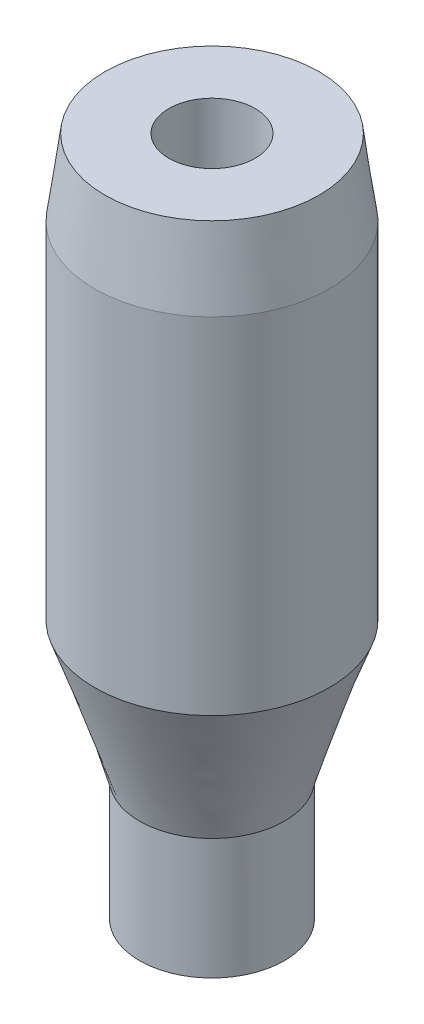
from build123d import *

# Parameters (mm, degrees)
SKETCH_1_R          = 2.1
EXTRUDE_1_DEPTH     = 7.5
SKETCH_5_R          = 3.4
EXTRUDE_2_DEPTH     = 10
SKETCH_7_R          = 3.1
SKETCH_6_R          = 3.4
SKETCH_8_R          = 1.25
CUT_EXTRUDE_1_DEPTH = 21.27831367


with BuildPart() as part:
    # 草图1 → 凸台-拉伸1 (new body)
    with BuildSketch(Plane(origin=(0, 0, 0), x_dir=(1, 0, 0), z_dir=(0, 1, 0))):
        with Locations(Location((0, 0, 0), (0, 0, 270))):
            Circle(SKETCH_1_R)
    extrude(amount=EXTRUDE_1_DEPTH)

    # 放样1: read off the stored shape, not the designer's step
    # 放样1: loft between two sections, ruled curve by curve
    loft_1_from = [
        Edge.make_bspline([(-3.388135234, 7.5, 0.283795064), (-3.955725362, 7.5, -6.492475403), (2.820545105, 7.5, -7.060065531), (3.388135234, 7.5, -0.283795064), (3.955725362, 7.5, 6.492475403), (-2.820545105, 7.5, 7.060065531), (-3.388135234, 7.5, 0.283795064)], [0, 0, 0, 0, 0.5, 0.5, 0.5, 1, 1, 1, 1], 3, [1, 0.333333333, 0.333333333, 1, 0.333333333, 0.333333333, 1]),
    ]
    loft_1_to = [
        Edge.make_bspline([(-1.894481315, 3.5, 0.906057696), (-3.706596707, 3.5, -2.882904933), (0.082365923, 3.5, -4.695020325), (1.894481315, 3.5, -0.906057696), (3.706596707, 3.5, 2.882904933), (-0.082365923, 3.5, 4.695020325), (-1.894481315, 3.5, 0.906057696)], [0, 0, 0, 0, 0.5, 0.5, 0.5, 1, 1, 1, 1], 3, [1, 0.333333333, 0.333333333, 1, 0.333333333, 0.333333333, 1]),
    ]
    loft_1 = Solid(Shell([*[Face.make_surface_from_curves(loft_1_from[k], loft_1_to[k]) for k in range(1)], Face(Wire(loft_1_from)), Face(Wire(loft_1_to))]))
    add(loft_1)

    # 草图5 → 凸台-拉伸2 (add)
    with BuildSketch(Plane(origin=(0, 7.5, 0), x_dir=(1, 0, 0), z_dir=(0, 1, 0))):
        with Locations(Location((0, 0, 0), (0, 0, 270))):
            Circle(SKETCH_5_R)
    extrude(amount=EXTRUDE_2_DEPTH)

    # 草图7 → 放样2 section 0
    with BuildSketch(Plane(origin=(0, 19.7, 0), x_dir=(1, 0, 0), z_dir=(0, 1, 0))):
        Circle(SKETCH_7_R)
    # 草图6 → 放样2 section 1
    with BuildSketch(Plane(origin=(0, 17.5, 0), x_dir=(1, 0, 0), z_dir=(0, 1, 0))):
        Circle(SKETCH_6_R)
    loft()

    # 草图8 → 切除-拉伸1 (cut, through all)
    with BuildSketch(Plane(origin=(0, 19.7, 0), x_dir=(1, 0, 0), z_dir=(0, 1, 0))):
        with Locations(Location((0, 0, 0), (0, 0, 270))):
            Circle(SKETCH_8_R)
    extrude(amount=-CUT_EXTRUDE_1_DEPTH, mode=Mode.SUBTRACT)


solid = part.part
